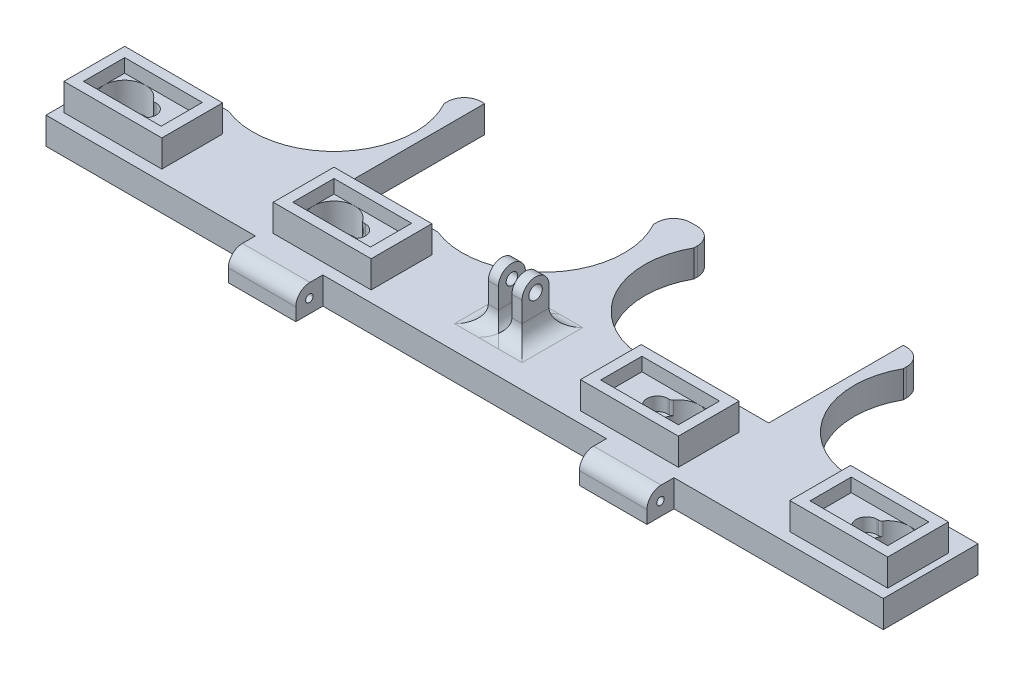
from build123d import *
from build123d.topology import SkipClean

# Parameters (mm, degrees)
ESQUISSE1_R                = 6.1
BOSS_EXTRU_1_DEPTH         = 8
ESQUISSE2_W                = 29
ESQUISSE2_H                = 18
BOSS_EXTRU_2_DEPTH         = 4
ESQUISSE3_W                = 29
ESQUISSE3_H                = 18
ESQUISSE3_W_2              = 23
ESQUISSE3_H_2              = 12.2
BOSS_EXTRU_3_DEPTH         = 4
ENL_V_MAT_EXTRU_1_DEPTH    = 4
R_P_TITION_LIN_AIRE1_COUNT = 2
R_P_TITION_LIN_AIRE1_PITCH = 62
ESQUISSE5_R                = 1.1
BOSS_EXTRU_4_DEPTH         = 20
ESQUISSE6_W                = 3
ESQUISSE6_H                = 8
BOSS_EXTRU_5_DEPTH         = 15
ENL_V_MAT_EXTRU_2_REACH    = 149.593
ESQUISSE7_R                = 2
CONG_1_R                   = 5
BOSS_EXTRU_6_START         = -3
ESQUISSE8_R                = 2
ESQUISSE8_R_2              = 1.7
BOSS_EXTRU_6_DEPTH         = 3


# Read off the part's stored shape, not the designer's step: Symétrie2
with BuildPart() as part:
    # Esquisse1 → Boss.-Extru.1 (new body)
    with BuildSketch(Plane(origin=(0, 0, 0), x_dir=(1, 0, 0), z_dir=(0, 1, 0))):
        with BuildLine():
            Line((0, 0), (6, 0))
            Line((6, 0), (36, 0))
            Line((36, 0), (62, 0))
            Line((62, 0), (62, 28.055987731))
            Line((62, 28.055987731), (36, 28.055987731))
            ThreePointArc((36, 28.055987731), (9.034681758, 34.39083629), (6, 61.923533231))
            Line((6, 61.923533231), (6, 62.923533231))
            ThreePointArc((6, 62.923533231), (4.535533906, 66.459067137), (1, 67.923533231))
            Line((1, 67.923533231), (0, 67.923533231))
            Line((0, 67.923533231), (0, 0))
        make_face()
        with Locations(Location((51, 12.304583192, 0), (0, 0, 270))):
            Circle(ESQUISSE1_R, mode=Mode.SUBTRACT)
    extrude(amount=BOSS_EXTRU_1_DEPTH)

    # Esquisse2 → Boss.-Extru.2 (add)
    with SkipClean():  # the faces are left unmerged after this step: merging them gives an invalid solid
        with BuildSketch(Plane(origin=(0, 8, 0), x_dir=(1, 0, 0), z_dir=(0, 1, 0))):
            with Locations((45.5, 12.304583192)):
                Rectangle(ESQUISSE2_W, ESQUISSE2_H)
            with BuildLine():
                Line((44.8, 15.404583192), (45.203449302, 15.404583192))
                ThreePointArc((45.203449302, 15.404583192), (45.663087861, 15.516477121), (46.019864893, 15.827118403))
                ThreePointArc((46.019864893, 15.827118403), (57.1, 12.304583192), (46.019864893, 8.782047981))
                ThreePointArc((46.019864893, 8.782047981), (45.663087861, 9.092689264), (45.203449302, 9.204583192))
                Line((45.203449302, 9.204583192), (44.8, 9.204583192))
                ThreePointArc((44.8, 9.204583192), (41.7, 12.304583192), (44.8, 15.404583192))
            make_face(mode=Mode.SUBTRACT)
        extrude(amount=BOSS_EXTRU_2_DEPTH)

    # Esquisse3 → Boss.-Extru.3 (add)
    with SkipClean():  # the faces are left unmerged after this step: merging them gives an invalid solid
        with BuildSketch(Plane(origin=(0, 12, 0), x_dir=(1, 0, 0), z_dir=(0, 1, 0))):
            with Locations((45.5, 12.304583192)):
                Rectangle(ESQUISSE3_W, ESQUISSE3_H)
            with Locations((45.6, 12.304583192)):
                Rectangle(ESQUISSE3_W_2, ESQUISSE3_H_2, mode=Mode.SUBTRACT)
        extrude(amount=BOSS_EXTRU_3_DEPTH)

    # Esquisse4 → Enlèv. mat.-Extru.1 (cut)
    with SkipClean():  # the faces are left unmerged after this step: merging them gives an invalid solid
        with BuildSketch(Plane.XZ):
            Polygon((47.7, -17.055987731), (54.3, -17.055987731), (55.193703609, -16.162284122), (57.721788353, -28.055987731), (54.3, -28.055987731), (47.7, -28.055987731), (44.278211647, -28.055987731), (46.806296391, -16.162284122), align=None)
        extrude(amount=-ENL_V_MAT_EXTRU_1_DEPTH, mode=Mode.SUBTRACT)

    # Répétition linéaire1: part ×2


with BuildPart() as part_1:
    with SkipClean():  # the faces are left unmerged after this step: merging them gives an invalid solid
        add(part.part)
        with Locations(*[(i * R_P_TITION_LIN_AIRE1_PITCH, 0, 0) for i in range(1, R_P_TITION_LIN_AIRE1_COUNT)]):
            add(part.part)

    # Esquisse5 → Boss.-Extru.4 (add)
    with SkipClean():  # the faces are left unmerged after this step: merging them gives an invalid solid
        with BuildSketch(Plane.ZY.offset(-62)):
            with BuildLine():
                Line((0, 8), (3.8, 8))
                ThreePointArc((3.8, 8), (6.769848481, 6.769848481), (8, 3.8))
                Line((8, 3.8), (8, 0))
                Line((8, 0), (0, 0))
                Line((0, 0), (0, 8))
            make_face()
            with Locations((4, 4)):
                Circle(ESQUISSE5_R, mode=Mode.SUBTRACT)
        extrude(amount=BOSS_EXTRU_4_DEPTH)

    # Symétrie2: part across plane


with BuildPart() as part_2:
    with SkipClean():  # the faces are left unmerged after this step: merging them gives an invalid solid
        add(part_1.part)
        add(part_1.part.mirror(Plane(origin=(0, 8, 0), x_dir=(0, 0, 1), z_dir=(1, 0, 0))))

    # Esquisse6 → Boss.-Extru.5 (add)
    with SkipClean():  # the faces are left unmerged after this step: merging them gives an invalid solid
        with BuildSketch(Plane(origin=(0, 8, 0), x_dir=(1, 0, 0), z_dir=(0, 1, 0))):
            with Locations((-3.5, 16)):
                Rectangle(ESQUISSE6_W, ESQUISSE6_H)
            with Locations((3.5, 16)):
                Rectangle(ESQUISSE6_W, ESQUISSE6_H)
        extrude(amount=BOSS_EXTRU_5_DEPTH)

    # Enlèv. mat.-Extru.2: up to this face of the body (flat: up to its plane)
    enl_v_mat_extru_2_end = Plane(part_2.part.faces().sort_by_distance((-5, 15.5, -16))[0])
    # Esquisse7 → Enlèv. mat.-Extru.2 (cut, up to the picked face)
    with BuildSketch(Plane(origin=(5, 0, 0), x_dir=(0, 0, -1), z_dir=(1, 0, 0)), mode=Mode.PRIVATE) as enl_v_mat_extru_2_sk1:
        with BuildLine():
            Line((12, 23), (12, 19))
            ThreePointArc((12, 19), (13.171572875, 21.828427125), (16, 23))
            Line((16, 23), (12, 23))
        make_face()
    enl_v_mat_extru_2_tool1 = split(extrude(enl_v_mat_extru_2_sk1.sketch, amount=-ENL_V_MAT_EXTRU_2_REACH, mode=Mode.PRIVATE), bisect_by=enl_v_mat_extru_2_end, keep=Keep.BOTH, mode=Mode.PRIVATE)
    # Esquisse7 → Enlèv. mat.-Extru.2 (cut, up to the picked face)
    with BuildSketch(Plane(origin=(5, 0, 0), x_dir=(0, 0, -1), z_dir=(1, 0, 0)), mode=Mode.PRIVATE) as enl_v_mat_extru_2_sk2:
        with BuildLine():
            Line((20, 23), (16, 23))
            ThreePointArc((16, 23), (18.828427125, 21.828427125), (20, 19))
            Line((20, 19), (20, 23))
        make_face()
    enl_v_mat_extru_2_tool2 = split(extrude(enl_v_mat_extru_2_sk2.sketch, amount=-ENL_V_MAT_EXTRU_2_REACH, mode=Mode.PRIVATE), bisect_by=enl_v_mat_extru_2_end, keep=Keep.BOTH, mode=Mode.PRIVATE)
    # Esquisse7 → Enlèv. mat.-Extru.2 (cut, up to the picked face)
    with BuildSketch(Plane(origin=(5, 0, 0), x_dir=(0, 0, -1), z_dir=(1, 0, 0)), mode=Mode.PRIVATE) as enl_v_mat_extru_2_sk3:
        with Locations((16, 19)):
            Circle(ESQUISSE7_R)
    enl_v_mat_extru_2_tool3 = split(extrude(enl_v_mat_extru_2_sk3.sketch, amount=-ENL_V_MAT_EXTRU_2_REACH, mode=Mode.PRIVATE), bisect_by=enl_v_mat_extru_2_end, keep=Keep.BOTH, mode=Mode.PRIVATE)
    add(enl_v_mat_extru_2_tool1.solids().sort_by(Axis((5, 22.106528, -12.893472), (-1, 0, 0)))[0], mode=Mode.SUBTRACT)
    add(enl_v_mat_extru_2_tool2.solids().sort_by(Axis((5, 22.106528, -19.106528), (-1, 0, 0)))[0], mode=Mode.SUBTRACT)
    add(enl_v_mat_extru_2_tool3.solids().sort_by(Axis((5, 19, -16), (-1, 0, 0)))[0], mode=Mode.SUBTRACT)

    # Congé1
    # the kernel refuses this fillet: 5 mm, written as the material it adds along each edge
    with BuildSketch(Plane(origin=(10.5, 8, -20), x_dir=(0, 0, -1), z_dir=(-1, 0, 0))) as cong_1_piece_1_section:
        with BuildLine():
            CenterArc((CONG_1_R, -CONG_1_R), CONG_1_R, 90, 90)
            Line((0, -CONG_1_R), (0, 0))
            Line((0, 0), (CONG_1_R, 0))
        make_face()
    cong_1_piece_1 = extrude(amount=15.5, mode=Mode.PRIVATE)
    cong_1_piece_1 = split(cong_1_piece_1, bisect_by=Plane(origin=(2, 9.131975571, -21.131975571), z_dir=(1, 0, 0)), keep=Keep.TOP, mode=Mode.PRIVATE)
    cong_1_piece_1 = split(cong_1_piece_1, bisect_by=Plane(origin=(5, 9.131975571, -21.131975571), z_dir=(-1, 0, 0)), keep=Keep.TOP, mode=Mode.PRIVATE)
    add(cong_1_piece_1)
    with BuildSketch(Plane(origin=(-2, 8, -20), x_dir=(0, 0, -1), z_dir=(-1, 0, 0)), Plane(origin=(-5, 8, -12), x_dir=(0, 0, 1), z_dir=(1, 0, 0)), Plane(origin=(2, 8, -12), x_dir=(0, 0, 1), z_dir=(1, 0, 0)), Plane(origin=(5, 8, -20), x_dir=(0, 0, -1), z_dir=(-1, 0, 0))) as cong_1_piece_2:
        with BuildLine():
            CenterArc((CONG_1_R, -CONG_1_R), CONG_1_R, 90, 90)
            Line((0, -CONG_1_R), (0, 0))
            Line((0, 0), (CONG_1_R, 0))
        make_face()
    extrude(amount=3)
    with BuildSketch(Plane(origin=(-5, 8, -20), x_dir=(-1, 0, 0), z_dir=(0, 0, 1)), Plane(origin=(-2, 8, -12), x_dir=(1, 0, 0), z_dir=(0, 0, -1)), Plane(origin=(2, 8, -20), x_dir=(-1, 0, 0), z_dir=(0, 0, 1)), Plane(origin=(5, 8, -12), x_dir=(1, 0, 0), z_dir=(0, 0, -1))) as cong_1_piece_3:
        with BuildLine():
            CenterArc((CONG_1_R, -CONG_1_R), CONG_1_R, 90, 90)
            Line((0, -CONG_1_R), (0, 0))
            Line((0, 0), (CONG_1_R, 0))
        make_face()
    extrude(amount=8)
    with BuildSketch(Plane(origin=(-5, 8, -12), x_dir=(0, 0, 1), z_dir=(1, 0, 0))) as cong_1_piece_4_section:
        with BuildLine():
            CenterArc((CONG_1_R, -CONG_1_R), CONG_1_R, 90, 90)
            Line((0, -CONG_1_R), (0, 0))
            Line((0, 0), (CONG_1_R, 0))
        make_face()
    cong_1_piece_4 = extrude(amount=15.5, mode=Mode.PRIVATE)
    cong_1_piece_4 = split(cong_1_piece_4, bisect_by=Plane(origin=(2, 9.131975571, -10.868024429), z_dir=(1, 0, 0)), keep=Keep.TOP, mode=Mode.PRIVATE)
    cong_1_piece_4 = split(cong_1_piece_4, bisect_by=Plane(origin=(5, 9.131975571, -10.868024429), z_dir=(-1, 0, 0)), keep=Keep.TOP, mode=Mode.PRIVATE)
    add(cong_1_piece_4)
    with BuildSketch(Plane(origin=(-10.5, 8, -12), x_dir=(0, 0, 1), z_dir=(1, 0, 0))) as cong_1_piece_5_section:
        with BuildLine():
            CenterArc((CONG_1_R, -CONG_1_R), CONG_1_R, 90, 90)
            Line((0, -CONG_1_R), (0, 0))
            Line((0, 0), (CONG_1_R, 0))
        make_face()
    cong_1_piece_5 = extrude(amount=15.5, mode=Mode.PRIVATE)
    cong_1_piece_5 = split(cong_1_piece_5, bisect_by=Plane(origin=(-2, 9.131975571, -10.868024429), z_dir=(-1, 0, 0)), keep=Keep.TOP, mode=Mode.PRIVATE)
    cong_1_piece_5 = split(cong_1_piece_5, bisect_by=Plane(origin=(-5, 9.131975571, -10.868024429), z_dir=(1, 0, 0)), keep=Keep.TOP, mode=Mode.PRIVATE)
    add(cong_1_piece_5)
    with BuildSketch(Plane(origin=(5, 8, -20), x_dir=(0, 0, -1), z_dir=(-1, 0, 0))) as cong_1_piece_6_section:
        with BuildLine():
            CenterArc((CONG_1_R, -CONG_1_R), CONG_1_R, 90, 90)
            Line((0, -CONG_1_R), (0, 0))
            Line((0, 0), (CONG_1_R, 0))
        make_face()
    cong_1_piece_6 = extrude(amount=15.5, mode=Mode.PRIVATE)
    cong_1_piece_6 = split(cong_1_piece_6, bisect_by=Plane(origin=(-2, 9.131975571, -21.131975571), z_dir=(-1, 0, 0)), keep=Keep.TOP, mode=Mode.PRIVATE)
    cong_1_piece_6 = split(cong_1_piece_6, bisect_by=Plane(origin=(-5, 9.131975571, -21.131975571), z_dir=(1, 0, 0)), keep=Keep.TOP, mode=Mode.PRIVATE)
    add(cong_1_piece_6)
    with BuildSketch(Plane(origin=(-2, 8, -12), x_dir=(1, 0, 0), z_dir=(0, 0, -1))) as cong_1_piece_7a_section:
        with BuildLine():
            CenterArc((CONG_1_R, -CONG_1_R), CONG_1_R, 90, 90)
            Line((0, -CONG_1_R), (0, 0))
            Line((0, 0), (CONG_1_R, 0))
        make_face()
    cong_1_piece_7a = extrude(amount=20.5, mode=Mode.PRIVATE)
    cong_1_piece_7a = split(cong_1_piece_7a, bisect_by=Plane(origin=(-0.868024429, 9.131975571, -20), z_dir=(0, 0, -1)), keep=Keep.TOP, mode=Mode.PRIVATE)
    with BuildSketch(Plane(origin=(10.5, 8, -20), x_dir=(0, 0, -1), z_dir=(-1, 0, 0))) as cong_1_piece_7b_section:
        with BuildLine():
            CenterArc((CONG_1_R, -CONG_1_R), CONG_1_R, 90, 90)
            Line((0, -CONG_1_R), (0, 0))
            Line((0, 0), (CONG_1_R, 0))
        make_face()
    cong_1_piece_7b = extrude(amount=15.5, mode=Mode.PRIVATE)
    cong_1_piece_7b = split(cong_1_piece_7b, bisect_by=Plane(origin=(2, 9.131975571, -21.131975571), z_dir=(-1, 0, 0)), keep=Keep.TOP, mode=Mode.PRIVATE)
    cong_1_piece_7b = split(cong_1_piece_7b, bisect_by=Plane(origin=(-2, 9.131975571, -21.131975571), z_dir=(1, 0, 0)), keep=Keep.TOP, mode=Mode.PRIVATE)
    cong_1_piece_7 = cong_1_piece_7a & cong_1_piece_7b
    add(cong_1_piece_7)
    with BuildSketch(Plane(origin=(-5, 8, -32.5), x_dir=(-1, 0, 0), z_dir=(0, 0, 1))) as cong_1_piece_8a_section:
        with BuildLine():
            CenterArc((CONG_1_R, -CONG_1_R), CONG_1_R, 90, 90)
            Line((0, -CONG_1_R), (0, 0))
            Line((0, 0), (CONG_1_R, 0))
        make_face()
    cong_1_piece_8a = extrude(amount=20.5, mode=Mode.PRIVATE)
    cong_1_piece_8a = split(cong_1_piece_8a, bisect_by=Plane(origin=(-6.131975571, 9.131975571, -20), z_dir=(0, 0, -1)), keep=Keep.TOP, mode=Mode.PRIVATE)
    with BuildSketch(Plane(origin=(-2, 8, -20), x_dir=(0, 0, -1), z_dir=(-1, 0, 0))) as cong_1_piece_8b_section:
        with BuildLine():
            CenterArc((CONG_1_R, -CONG_1_R), CONG_1_R, 90, 90)
            Line((0, -CONG_1_R), (0, 0))
            Line((0, 0), (CONG_1_R, 0))
        make_face()
    cong_1_piece_8b = extrude(amount=15.5, mode=Mode.PRIVATE)
    cong_1_piece_8b = split(cong_1_piece_8b, bisect_by=Plane(origin=(-5, 9.131975571, -21.131975571), z_dir=(-1, 0, 0)), keep=Keep.TOP, mode=Mode.PRIVATE)
    cong_1_piece_8 = cong_1_piece_8a & cong_1_piece_8b
    add(cong_1_piece_8)
    with BuildSketch(Plane(origin=(-17.5, 8, -12), x_dir=(0, 0, 1), z_dir=(1, 0, 0))) as cong_1_piece_9a_section:
        with BuildLine():
            CenterArc((CONG_1_R, -CONG_1_R), CONG_1_R, 90, 90)
            Line((0, -CONG_1_R), (0, 0))
            Line((0, 0), (CONG_1_R, 0))
        make_face()
    cong_1_piece_9a = extrude(amount=15.5, mode=Mode.PRIVATE)
    cong_1_piece_9a = split(cong_1_piece_9a, bisect_by=Plane(origin=(-5, 9.131975571, -10.868024429), z_dir=(-1, 0, 0)), keep=Keep.TOP, mode=Mode.PRIVATE)
    with BuildSketch(Plane(origin=(-5, 8, -20), x_dir=(-1, 0, 0), z_dir=(0, 0, 1))) as cong_1_piece_9b_section:
        with BuildLine():
            CenterArc((CONG_1_R, -CONG_1_R), CONG_1_R, 90, 90)
            Line((0, -CONG_1_R), (0, 0))
            Line((0, 0), (CONG_1_R, 0))
        make_face()
    cong_1_piece_9b = extrude(amount=20.5, mode=Mode.PRIVATE)
    cong_1_piece_9b = split(cong_1_piece_9b, bisect_by=Plane(origin=(-6.131975571, 9.131975571, 0), z_dir=(0, 0, -1)), keep=Keep.TOP, mode=Mode.PRIVATE)
    cong_1_piece_9b = split(cong_1_piece_9b, bisect_by=Plane(origin=(-6.131975571, 9.131975571, -12), z_dir=(0, 0, 1)), keep=Keep.TOP, mode=Mode.PRIVATE)
    cong_1_piece_9 = cong_1_piece_9a & cong_1_piece_9b
    add(cong_1_piece_9)
    with BuildSketch(Plane(origin=(-2, 8, 0.5), x_dir=(1, 0, 0), z_dir=(0, 0, -1))) as cong_1_piece_10a_section:
        with BuildLine():
            CenterArc((CONG_1_R, -CONG_1_R), CONG_1_R, 90, 90)
            Line((0, -CONG_1_R), (0, 0))
            Line((0, 0), (CONG_1_R, 0))
        make_face()
    cong_1_piece_10a = extrude(amount=20.5, mode=Mode.PRIVATE)
    cong_1_piece_10a = split(cong_1_piece_10a, bisect_by=Plane(origin=(-0.868024429, 9.131975571, 0), z_dir=(0, 0, -1)), keep=Keep.TOP, mode=Mode.PRIVATE)
    cong_1_piece_10a = split(cong_1_piece_10a, bisect_by=Plane(origin=(-0.868024429, 9.131975571, -12), z_dir=(0, 0, 1)), keep=Keep.TOP, mode=Mode.PRIVATE)
    with BuildSketch(Plane(origin=(-5, 8, -12), x_dir=(0, 0, 1), z_dir=(1, 0, 0))) as cong_1_piece_10b_section:
        with BuildLine():
            CenterArc((CONG_1_R, -CONG_1_R), CONG_1_R, 90, 90)
            Line((0, -CONG_1_R), (0, 0))
            Line((0, 0), (CONG_1_R, 0))
        make_face()
    cong_1_piece_10b = extrude(amount=15.5, mode=Mode.PRIVATE)
    cong_1_piece_10b = split(cong_1_piece_10b, bisect_by=Plane(origin=(2, 9.131975571, -10.868024429), z_dir=(-1, 0, 0)), keep=Keep.TOP, mode=Mode.PRIVATE)
    cong_1_piece_10b = split(cong_1_piece_10b, bisect_by=Plane(origin=(-2, 9.131975571, -10.868024429), z_dir=(1, 0, 0)), keep=Keep.TOP, mode=Mode.PRIVATE)
    cong_1_piece_10 = cong_1_piece_10a & cong_1_piece_10b
    add(cong_1_piece_10)
    with BuildSketch(Plane(origin=(2, 8, -32.5), x_dir=(-1, 0, 0), z_dir=(0, 0, 1))) as cong_1_piece_11a_section:
        with BuildLine():
            CenterArc((CONG_1_R, -CONG_1_R), CONG_1_R, 90, 90)
            Line((0, -CONG_1_R), (0, 0))
            Line((0, 0), (CONG_1_R, 0))
        make_face()
    cong_1_piece_11a = extrude(amount=20.5, mode=Mode.PRIVATE)
    cong_1_piece_11a = split(cong_1_piece_11a, bisect_by=Plane(origin=(0.868024429, 9.131975571, -20), z_dir=(0, 0, -1)), keep=Keep.TOP, mode=Mode.PRIVATE)
    with BuildSketch(Plane(origin=(5, 8, -20), x_dir=(0, 0, -1), z_dir=(-1, 0, 0))) as cong_1_piece_11b_section:
        with BuildLine():
            CenterArc((CONG_1_R, -CONG_1_R), CONG_1_R, 90, 90)
            Line((0, -CONG_1_R), (0, 0))
            Line((0, 0), (CONG_1_R, 0))
        make_face()
    cong_1_piece_11b = extrude(amount=15.5, mode=Mode.PRIVATE)
    cong_1_piece_11b = split(cong_1_piece_11b, bisect_by=Plane(origin=(2, 9.131975571, -21.131975571), z_dir=(-1, 0, 0)), keep=Keep.TOP, mode=Mode.PRIVATE)
    cong_1_piece_11b = split(cong_1_piece_11b, bisect_by=Plane(origin=(-2, 9.131975571, -21.131975571), z_dir=(1, 0, 0)), keep=Keep.TOP, mode=Mode.PRIVATE)
    cong_1_piece_11 = cong_1_piece_11a & cong_1_piece_11b
    add(cong_1_piece_11)
    with BuildSketch(Plane(origin=(2, 8, -20), x_dir=(-1, 0, 0), z_dir=(0, 0, 1))) as cong_1_piece_12a_section:
        with BuildLine():
            CenterArc((CONG_1_R, -CONG_1_R), CONG_1_R, 90, 90)
            Line((0, -CONG_1_R), (0, 0))
            Line((0, 0), (CONG_1_R, 0))
        make_face()
    cong_1_piece_12a = extrude(amount=20.5, mode=Mode.PRIVATE)
    cong_1_piece_12a = split(cong_1_piece_12a, bisect_by=Plane(origin=(0.868024429, 9.131975571, 0), z_dir=(0, 0, -1)), keep=Keep.TOP, mode=Mode.PRIVATE)
    cong_1_piece_12a = split(cong_1_piece_12a, bisect_by=Plane(origin=(0.868024429, 9.131975571, -12), z_dir=(0, 0, 1)), keep=Keep.TOP, mode=Mode.PRIVATE)
    with BuildSketch(Plane(origin=(-10.5, 8, -12), x_dir=(0, 0, 1), z_dir=(1, 0, 0))) as cong_1_piece_12b_section:
        with BuildLine():
            CenterArc((CONG_1_R, -CONG_1_R), CONG_1_R, 90, 90)
            Line((0, -CONG_1_R), (0, 0))
            Line((0, 0), (CONG_1_R, 0))
        make_face()
    cong_1_piece_12b = extrude(amount=15.5, mode=Mode.PRIVATE)
    cong_1_piece_12b = split(cong_1_piece_12b, bisect_by=Plane(origin=(2, 9.131975571, -10.868024429), z_dir=(-1, 0, 0)), keep=Keep.TOP, mode=Mode.PRIVATE)
    cong_1_piece_12b = split(cong_1_piece_12b, bisect_by=Plane(origin=(-2, 9.131975571, -10.868024429), z_dir=(1, 0, 0)), keep=Keep.TOP, mode=Mode.PRIVATE)
    cong_1_piece_12 = cong_1_piece_12a & cong_1_piece_12b
    add(cong_1_piece_12)
    with BuildSketch(Plane(origin=(2, 8, -12), x_dir=(0, 0, 1), z_dir=(1, 0, 0))) as cong_1_piece_13a_section:
        with BuildLine():
            CenterArc((CONG_1_R, -CONG_1_R), CONG_1_R, 90, 90)
            Line((0, -CONG_1_R), (0, 0))
            Line((0, 0), (CONG_1_R, 0))
        make_face()
    cong_1_piece_13a = extrude(amount=15.5, mode=Mode.PRIVATE)
    cong_1_piece_13a = split(cong_1_piece_13a, bisect_by=Plane(origin=(5, 9.131975571, -10.868024429), z_dir=(1, 0, 0)), keep=Keep.TOP, mode=Mode.PRIVATE)
    with BuildSketch(Plane(origin=(5, 8, 0.5), x_dir=(1, 0, 0), z_dir=(0, 0, -1))) as cong_1_piece_13b_section:
        with BuildLine():
            CenterArc((CONG_1_R, -CONG_1_R), CONG_1_R, 90, 90)
            Line((0, -CONG_1_R), (0, 0))
            Line((0, 0), (CONG_1_R, 0))
        make_face()
    cong_1_piece_13b = extrude(amount=20.5, mode=Mode.PRIVATE)
    cong_1_piece_13b = split(cong_1_piece_13b, bisect_by=Plane(origin=(6.131975571, 9.131975571, 0), z_dir=(0, 0, -1)), keep=Keep.TOP, mode=Mode.PRIVATE)
    cong_1_piece_13b = split(cong_1_piece_13b, bisect_by=Plane(origin=(6.131975571, 9.131975571, -12), z_dir=(0, 0, 1)), keep=Keep.TOP, mode=Mode.PRIVATE)
    cong_1_piece_13 = cong_1_piece_13a & cong_1_piece_13b
    add(cong_1_piece_13)
    with BuildSketch(Plane(origin=(5, 8, -12), x_dir=(1, 0, 0), z_dir=(0, 0, -1))) as cong_1_piece_14a_section:
        with BuildLine():
            CenterArc((CONG_1_R, -CONG_1_R), CONG_1_R, 90, 90)
            Line((0, -CONG_1_R), (0, 0))
            Line((0, 0), (CONG_1_R, 0))
        make_face()
    cong_1_piece_14a = extrude(amount=20.5, mode=Mode.PRIVATE)
    cong_1_piece_14a = split(cong_1_piece_14a, bisect_by=Plane(origin=(6.131975571, 9.131975571, -20), z_dir=(0, 0, -1)), keep=Keep.TOP, mode=Mode.PRIVATE)
    with BuildSketch(Plane(origin=(17.5, 8, -20), x_dir=(0, 0, -1), z_dir=(-1, 0, 0))) as cong_1_piece_14b_section:
        with BuildLine():
            CenterArc((CONG_1_R, -CONG_1_R), CONG_1_R, 90, 90)
            Line((0, -CONG_1_R), (0, 0))
            Line((0, 0), (CONG_1_R, 0))
        make_face()
    cong_1_piece_14b = extrude(amount=15.5, mode=Mode.PRIVATE)
    cong_1_piece_14b = split(cong_1_piece_14b, bisect_by=Plane(origin=(5, 9.131975571, -21.131975571), z_dir=(1, 0, 0)), keep=Keep.TOP, mode=Mode.PRIVATE)
    cong_1_piece_14 = cong_1_piece_14a & cong_1_piece_14b
    add(cong_1_piece_14)

    # Esquisse8 → Boss.-Extru.6 (add)
    with BuildSketch(Plane.ZY.offset(5).offset(BOSS_EXTRU_6_START)):
        with Locations(Location((-16, 19, 0), (0, 0, 180))):
            Circle(ESQUISSE8_R)
        with Locations((-16, 19)):
            Circle(ESQUISSE8_R_2, mode=Mode.SUBTRACT)
    extrude(amount=BOSS_EXTRU_6_DEPTH)


solid = part_2.part
